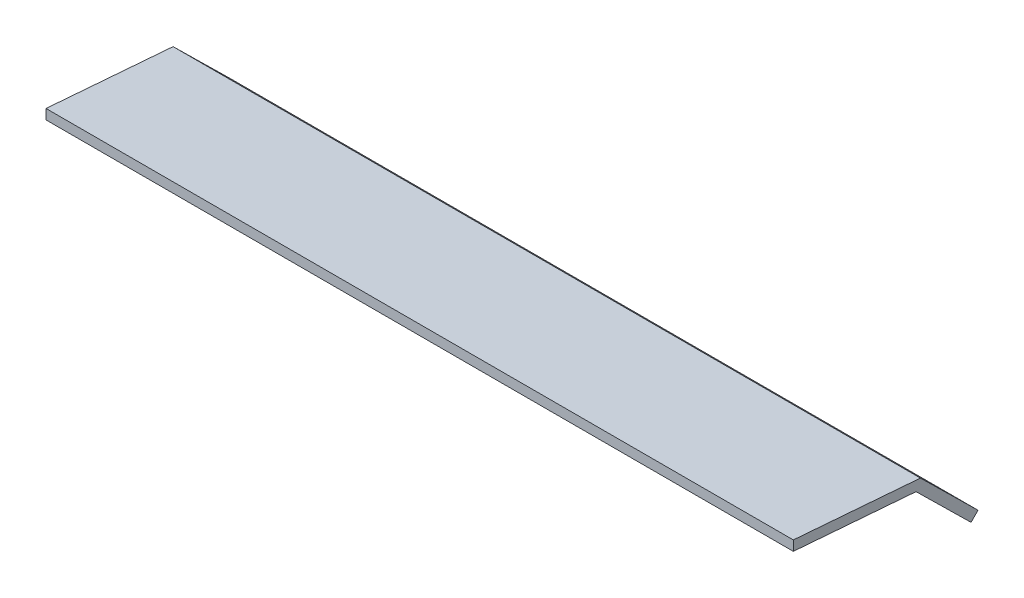
from build123d import *

# Parameters (mm, degrees)
BOSS_EXTRUDE1_DEPTH = 119.85625


with BuildPart() as part:
    # Sketch1 → Boss-Extrude1 (new, symmetric)
    with BuildSketch(Plane(origin=(0, 0, 0), x_dir=(0, 0, -1), z_dir=(1, 0, 0))):
        Polygon((0, 0), (0, 3.184811635), (40.762900177, -0.022300578), (59.239029619, -18.178905948), (57.013632508, -20.443466104), (39.361772519, -3.096875365), align=None)
    extrude(amount=BOSS_EXTRUDE1_DEPTH, both=True)


solid = part.part
